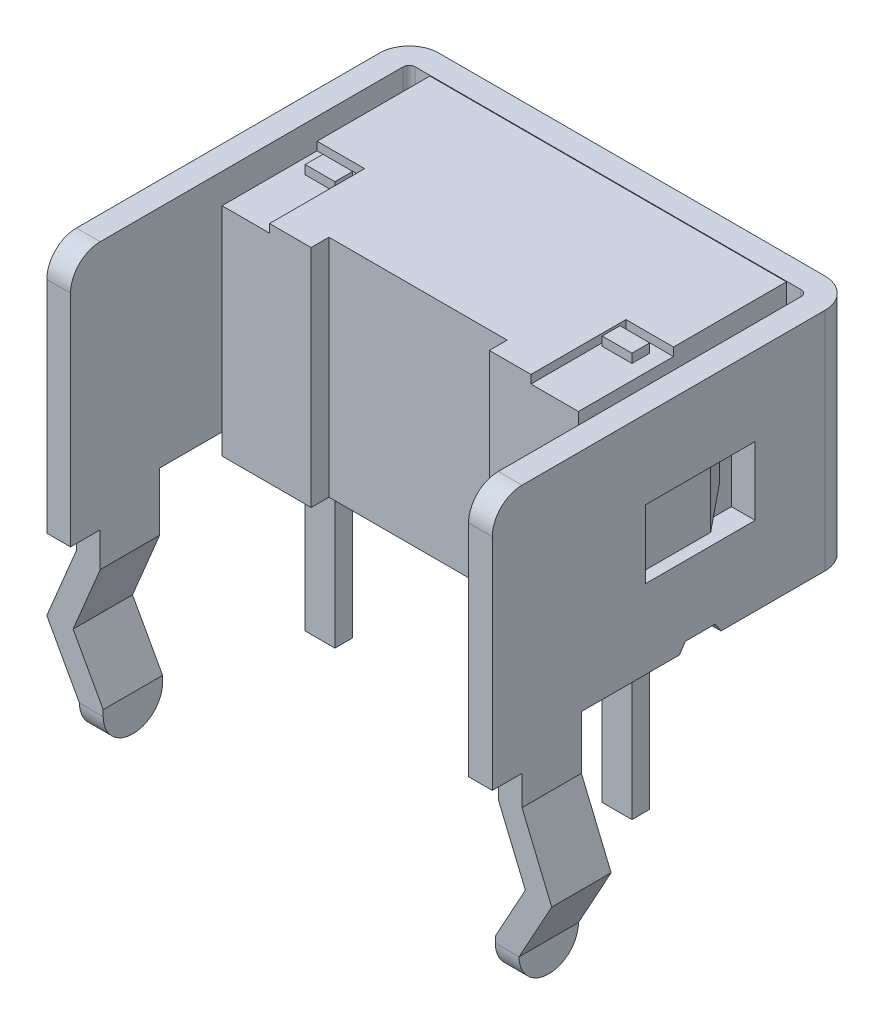
from build123d import *

# Parameters (mm, degrees)
EXTRUDE1_DEPTH      = 3.8
EXTRUDE_THIN1_DEPTH = 3.8
SKETCH3_W           = 0.8
SKETCH3_H           = 1.6
CUT_EXTRUDE1_DEPTH  = 0.15
FILLET1_R           = 0.5
SKETCH9_W           = 3.2
SKETCH9_H           = 1.7
SKETCH9_W_2         = 3
SKETCH9_H_2         = 1.5
CUT_EXTRUDE5_DEPTH  = 0.4
SKETCH11_W          = 6
SKETCH11_H          = 3.5
CUT_EXTRUDE6_DEPTH  = 0.01
FILLET6_R           = 0.1
EXTRUDE2_OUTLINE_W  = 2.961598858
EXTRUDE2_OUTLINE_H  = 1.461598858
EXTRUDE2_DEPTH      = 1.5
EXTRUDE2_DRAFT      = 1
FILLET7_R           = 0.2
SKETCH13_W          = 1.27
SKETCH13_H          = 0.4
EXTRUDE3_DEPTH      = 0.4
CUT_EXTRUDE7_DEPTH  = 0.4
CUT_EXTRUDE8_START  = -9.5
CUT_EXTRUDE8_DEPTH  = 2.4
EXTRUDE4_START      = 0.1
EXTRUDE4_DEPTH      = 0.95
SKETCH16_W          = 0.75
SKETCH16_H          = 2
EXTRUDE5_DEPTH      = 0.375
FILLET8_R           = 0.374
EXTRUDE6_DEPTH      = 0.5
EXTRUDE6_DEPTH_BACK = 0.5
EXTRUDE6_START      = -1
SKETCH17_W          = 0.4
SKETCH17_H          = 0.4
FILLET9_R           = 0.5
SKETCH17_3_W        = 0.4
SKETCH17_3_H        = 0.4
EXTRUDE7_DEPTH      = 0.5
EXTRUDE8_DEPTH      = 0.15
EXTRUDE8_DEPTH_BACK = 0.15
EXTRUDE8_START      = -3.5
SKETCH18_W          = 0.5
SKETCH18_H          = 0.15


# Read off the part's stored shape, not the designer's step: Extrude2
with BuildPart() as part:
    # Sketch1 → Extrude1 (new body)
    with BuildSketch(Plane(origin=(0, 0, 0), x_dir=(1, 0, 0), z_dir=(0, 1, 0))):
        Polygon((-1.5, -1.75), (-1.5, -1.45), (1.5, -1.45), (1.5, -1.75), (3, -1.75), (3, 1.75), (-3, 1.75), (-3, -1.75), align=None)
    extrude(amount=EXTRUDE1_DEPTH)

    # Sketch2 → Extrude-Thin1 (add)
    with BuildSketch(Plane(origin=(0, 0, 0), x_dir=(1, 0, 0), z_dir=(0, 1, 0))):
        Polygon((-3.75, -3.95), (-3.75, 2.15), (3.75, 2.15), (3.75, -3.95), (3.35, -3.95), (3.35, 1.75), (-3.35, 1.75), (-3.35, -3.95), align=None)
    extrude(amount=EXTRUDE_THIN1_DEPTH)

    # Sketch3 → Cut-Extrude1 (cut)
    with BuildSketch(Plane(origin=(0, 3.8, 0), x_dir=(-1, 0, 0), z_dir=(0, 1, 0))):
        with Locations((2.6, 0.95)):
            Rectangle(SKETCH3_W, SKETCH3_H)
        with Locations((-2.6, 0.95)):
            Rectangle(SKETCH3_W, SKETCH3_H)
    extrude(amount=-CUT_EXTRUDE1_DEPTH, mode=Mode.SUBTRACT)

    # Fillet1
    fillet1_edges = [part.edges().sort_by_distance(p)[0] for p in [
        (3.55, 3.8, 3.95),
        (3.75, 1.9, -2.15),
        (-3.75, 1.9, -2.15),
        (-3.55, 3.8, 3.95),
    ]]
    fillet(fillet1_edges, radius=FILLET1_R)

    # Sketch9 → Cut-Extrude5 (cut)
    # profile 1 of 2: a face of its own
    with BuildSketch(Plane(origin=(0, 0, -2.15), x_dir=(-1, 0, 0), z_dir=(0, 0, -1))):
        with Locations((0, 1.9)):
            Rectangle(SKETCH9_W, SKETCH9_H)
        with Locations((0, 1.9)):
            Rectangle(SKETCH9_W_2, SKETCH9_H_2, mode=Mode.SUBTRACT)
    # profile 2 of 2: a face of its own
    with BuildSketch(Plane(origin=(0, 0, -2.15), x_dir=(-1, 0, 0), z_dir=(0, 0, -1))):
        with Locations((0, 1.9)):
            Rectangle(SKETCH9_W_2, SKETCH9_H_2)
    extrude(amount=-CUT_EXTRUDE5_DEPTH, mode=Mode.SUBTRACT)

    # Sketch11 → Cut-Extrude6 (cut)
    with BuildSketch(Plane(origin=(0, 3.8, 0), x_dir=(-1, 0, 0), z_dir=(0, 1, 0))):
        Rectangle(SKETCH11_W, SKETCH11_H)
    extrude(amount=-CUT_EXTRUDE6_DEPTH, mode=Mode.SUBTRACT)

    # Fillet6
    fillet6_edges = [part.edges().sort_by_distance(p)[0] for p in [
        (-3.35, 1.9, -1.75),
        (3.35, 1.9, -1.75),
    ]]
    fillet(fillet6_edges, radius=FILLET6_R)


with BuildPart() as extrude2_tool:
    # Extrude2 outline → Extrude2 (with draft: the straight prism first)
    with BuildSketch(Plane(origin=(0, 0, -3.25), x_dir=(-1, 0, 0), z_dir=(0, 0, -1))):
        with Locations((0, 1.9)):
            Rectangle(EXTRUDE2_OUTLINE_W, EXTRUDE2_OUTLINE_H)
    extrude(amount=-EXTRUDE2_DEPTH)
    # Extrude2: the draft: its side faces are tilted about the plane it starts from
    extrude2_sides = [extrude2_tool.faces().sort_by_distance(p)[0] for p in [
        (-1.480799429, 1.9, -2.5),
        (0, 2.630799429, -2.5),
        (1.480799429, 1.9, -2.5),
        (0, 1.169200571, -2.5),
    ]]
    draft(extrude2_sides, Plane(origin=(0, 0, -3.25), x_dir=(-1, 0, 0), z_dir=(0, 0, -1)), EXTRUDE2_DRAFT)


with BuildPart() as part_1:
    add(part.part)

    # Extrude2: add extrude2_tool
    add(extrude2_tool.part)

    # Fillet7
    fillet7_edges = [part_1.edges().sort_by_distance(p)[0] for p in [
        (-1.493890728, 1.156109272, -2.5),
        (-1.480799429, 1.9, -3.25),
        (-1.493890728, 2.643890728, -2.5),
        (0, 2.630799429, -3.25),
        (1.493890728, 2.643890728, -2.5),
        (1.493890728, 1.156109272, -2.5),
        (1.480799429, 1.9, -3.25),
        (0, 1.169200571, -3.25),
    ]]
    fillet(fillet7_edges, radius=FILLET7_R)

    # Sketch13 → Extrude3 (add)
    with BuildSketch(Plane(origin=(0, 0, -2.15), x_dir=(-1, 0, 0), z_dir=(0, 0, -1))):
        with Locations((0, -0.2)):
            Rectangle(SKETCH13_W, SKETCH13_H)
    extrude(amount=-EXTRUDE3_DEPTH)

    # Sketch14 → Cut-Extrude7 (cut)
    with BuildSketch(Plane.ZY.offset(3.75)):
        Polygon((-0.475, 1.325), (0.45, 1.325), (1.375, 1.325), (1.375, 2.475), (-0.475, 2.475), align=None)
        Polygon((0.2, 0.15), (0.1, 0), (0.8, 0), (0.7, 0.15), align=None)
    extrude(amount=-CUT_EXTRUDE7_DEPTH, mode=Mode.SUBTRACT)

    # Sketch14<3> → Cut-Extrude8 (cut)
    with BuildSketch(Plane.ZY.offset(3.75).offset(CUT_EXTRUDE8_START)):
        Polygon((-0.475, 1.325), (0.45, 1.325), (1.375, 1.325), (1.375, 2.475), (-0.475, 2.475), align=None)
        Polygon((0.2, 0.15), (0.1, 0), (0.8, 0), (0.7, 0.15), align=None)
    extrude(amount=CUT_EXTRUDE8_DEPTH, mode=Mode.SUBTRACT)

    # Sketch15 → Extrude4 (add)
    with BuildSketch(Plane(origin=(0, 1.325, 0), x_dir=(-1, 0, 0), z_dir=(0, 1, 0)).offset(EXTRUDE4_START)):
        Polygon((3, 1.375), (3.65, 1.375), (3.65, 0.175), (3, -0.625), align=None)
        Polygon((-3, -0.625), (-3, 1.375), (-3.65, 1.375), (-3.65, 0.175), align=None)
    extrude(amount=EXTRUDE4_DEPTH)

    # Sketch16 → Extrude5 (add)
    with BuildSketch(Plane(origin=(0, 0, -2.15), x_dir=(-1, 0, 0), z_dir=(0, 0, -1))):
        with Locations((-2.625, 1.9)):
            Rectangle(SKETCH16_W, SKETCH16_H)
        with Locations((2.625, 1.9)):
            Rectangle(SKETCH16_W, SKETCH16_H)
    extrude(amount=EXTRUDE5_DEPTH)

    # Fillet8
    fillet8_edges = [part_1.edges().sort_by_distance(p)[0] for p in [
        (3, 2.9, -2.3375),
        (3, 0.9, -2.3375),
        (2.25, 0.9, -2.3375),
        (2.25, 2.9, -2.3375),
        (3, 1.9, -2.525),
        (2.625, 0.9, -2.525),
        (2.25, 1.9, -2.525),
        (2.625, 2.9, -2.525),
        (-3, 2.9, -2.3375),
        (-2.25, 2.9, -2.3375),
        (-2.25, 0.9, -2.3375),
        (-3, 0.9, -2.3375),
        (-2.625, 2.9, -2.525),
        (-2.25, 1.9, -2.525),
        (-2.625, 0.9, -2.525),
        (-3, 1.9, -2.525),
    ]]
    fillet(fillet8_edges, radius=FILLET8_R)

    # Sketch17 → Extrude6 (add, two sides: drawn at the far end of the back side and taken through both)
    with BuildSketch(Plane.XY.offset(3.95).offset(EXTRUDE6_START - EXTRUDE6_DEPTH_BACK)):
        Polygon((-3.35, -0.4), (-3.75, -0.4), (-3.75, -0.9), (-4.25, -2.1), (-3.7, -3.1), (-3.7, -3.6), (-3.5, -3.6), (-3.3, -3.6), (-3.3, -2.997257294), (-3.806677376, -2.076025702), (-3.35, -0.98), align=None)
        with Locations((-3.55, -0.2)):
            Rectangle(SKETCH17_W, SKETCH17_H)
        with Locations((3.55, -0.2)):
            Rectangle(SKETCH17_W, SKETCH17_H)
        Polygon((3.75, -0.4), (3.35, -0.4), (3.35, -0.98), (3.806677376, -2.076025702), (3.3, -2.997257294), (3.3, -3.6), (3.5, -3.6), (3.7, -3.6), (3.7, -3.1), (4.25, -2.1), (3.75, -0.9), align=None)
    extrude(amount=EXTRUDE6_DEPTH + EXTRUDE6_DEPTH_BACK)

    # Fillet9
    fillet9_edges = [part_1.edges().sort_by_distance(p)[0] for p in [
        (3.5, -3.6, 3.45),
        (3.5, -3.6, 2.45),
        (-3.5, -3.6, 3.45),
        (-3.5, -3.6, 2.45),
    ]]
    fillet(fillet9_edges, radius=FILLET9_R - 0.0001)  # a hair under: the kernel refuses the full size

    # Sketch17<3> → Extrude7 (add)
    with BuildSketch(Plane.XY.offset(3.95)):
        with Locations((-3.55, -0.2)):
            Rectangle(SKETCH17_3_W, SKETCH17_3_H)
        with Locations((3.55, -0.2)):
            Rectangle(SKETCH17_3_W, SKETCH17_3_H)
    extrude(amount=-EXTRUDE7_DEPTH)

    # Sketch18 → Extrude8 (add, two sides: drawn at the far end of the back side and taken through both)
    with BuildSketch(Plane.XY.offset(3.95).offset(EXTRUDE8_START - EXTRUDE8_DEPTH_BACK)):
        Polygon((2.75, 0), (2.25, 0), (2.25, -3), (2.5, -3), (2.75, -3), align=None)
        Polygon((-2.5, -3), (-2.25, -3), (-2.25, 0), (-2.75, 0), (-2.75, -3), align=None)
        with Locations((-2.5, 3.725)):
            Rectangle(SKETCH18_W, SKETCH18_H)
        with Locations((2.5, 3.725)):
            Rectangle(SKETCH18_W, SKETCH18_H)
    extrude(amount=EXTRUDE8_DEPTH + EXTRUDE8_DEPTH_BACK)


solid = part_1.part
